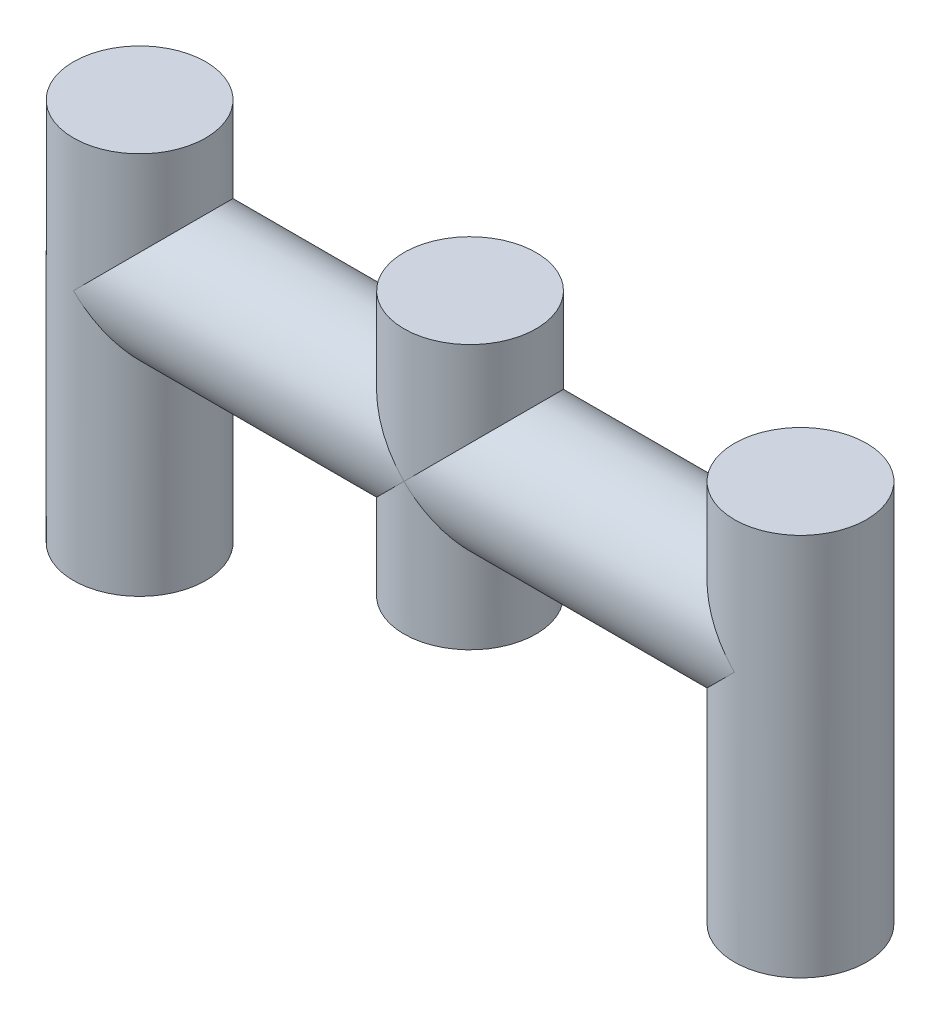
from build123d import *

# Parameters (mm, degrees)
SKETCH2_R           = 2.5
BOSS_EXTRUDE2_DEPTH = 10
SKETCH3_R           = 2.5
BOSS_EXTRUDE3_DEPTH = 12.5
BOSS_EXTRUDE4_DEPTH = 10
BOSS_EXTRUDE5_START = 4.5
SKETCH5_R           = 2.5
BOSS_EXTRUDE5_DEPTH = 4.5


with BuildPart() as part:
    # Sketch2 → Boss-Extrude2 (new body)
    with BuildSketch(Plane(origin=(0, 0, 0), x_dir=(1, 0, 0), z_dir=(0, 1, 0))):
        Circle(SKETCH2_R)
    boss_extrude2 = extrude(amount=BOSS_EXTRUDE2_DEPTH)

    # Sketch3 → Boss-Extrude3 (add)
    with BuildSketch(Plane(origin=(0, 0, 0), x_dir=(0, 0, -1), z_dir=(1, 0, 0))):
        with Locations((0, 5)):
            Circle(SKETCH3_R)
    boss_extrude3 = extrude(amount=BOSS_EXTRUDE3_DEPTH)

    # Sketch4 → Boss-Extrude4 (add)
    with BuildSketch(Plane(origin=(0, 0, 0), x_dir=(1, 0, 0), z_dir=(0, 1, 0))):
        with BuildLine():
            Line((12.5, 2.5), (12.5, -2.5))
            ThreePointArc((12.5, -2.5), (10, 0), (12.5, 2.5))
        make_face()
    boss_extrude4 = extrude(amount=BOSS_EXTRUDE4_DEPTH)

    # Mirror5: Boss-Extrude2, Boss-Extrude3, Boss-Extrude4 across plane
    add(boss_extrude2.mirror(Plane(origin=(12.5, 5, 0), x_dir=(0, 0, 1), z_dir=(1, 0, 0))))
    add(boss_extrude3.mirror(Plane(origin=(12.5, 5, 0), x_dir=(0, 0, 1), z_dir=(1, 0, 0))))
    add(boss_extrude4.mirror(Plane(origin=(12.5, 5, 0), x_dir=(0, 0, 1), z_dir=(1, 0, 0))))

    # Sketch5 → Boss-Extrude5 (add)
    with BuildSketch(Plane.XZ.offset(BOSS_EXTRUDE5_START)):
        Circle(SKETCH5_R)
        with Locations((25, 0)):
            Circle(SKETCH5_R)
    extrude(amount=-BOSS_EXTRUDE5_DEPTH)


solid = part.part
